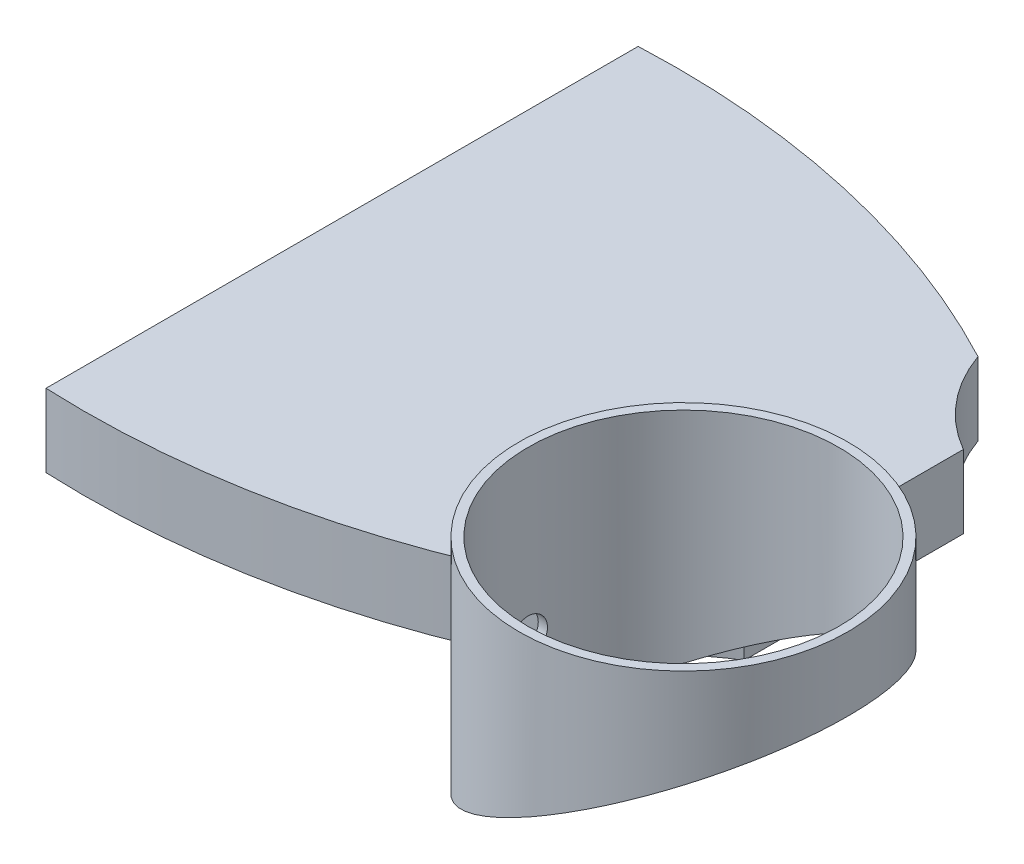
from build123d import *

# Parameters (mm, degrees)
SKETCH2_R               = 45
SKETCH2_R_2             = 42.5
BOSS_EXTRUDE1_DEPTH     = 60
CUT_EXTRUDE1_DEPTH      = 88.464278423
CUT_EXTRUDE1_DEPTH_BACK = 88.464278423
CUT_EXTRUDE2_DEPTH      = 88.464278423
CUT_EXTRUDE2_DEPTH_BACK = 88.464278423
SKETCH4_R               = 5
BOSS_EXTRUDE2_DEPTH     = 20
MIRROR1_DEPTH           = 20


# Read off the part's stored shape, not the designer's step: Mirror1
with BuildPart() as part:
    # Sketch2 → Boss-Extrude1 (new body)
    with BuildSketch(Plane(origin=(0, 0, 0), x_dir=(1, 0, 0), z_dir=(0, 1, 0))):
        with Locations(Location((0, 0, 0), (0, 0, 270))):
            Circle(SKETCH2_R)
        with Locations(Location((0, 0, 0), (0, 0, 270))):
            Circle(SKETCH2_R_2, mode=Mode.SUBTRACT)
    extrude(amount=BOSS_EXTRUDE1_DEPTH)

    # Sketch3 → Cut-Extrude1 (cut, two sides: drawn at the far end of the back side and taken through both)
    with BuildSketch(Plane.XY.offset(-CUT_EXTRUDE1_DEPTH_BACK)):
        Polygon((-30, 0), (45, 40), (45, 0), align=None)
    extrude(amount=CUT_EXTRUDE1_DEPTH + CUT_EXTRUDE1_DEPTH_BACK, mode=Mode.SUBTRACT)

    # Sketch4 → Cut-Extrude2 (cut, two sides: drawn at the far end of the back side and taken through both)
    with BuildSketch(Plane(origin=(0, 0, 0), x_dir=(0, 0, -1), z_dir=(1, 0, 0)).offset(-CUT_EXTRUDE2_DEPTH_BACK)):
        with Locations((0, 15)):
            Circle(SKETCH4_R)
    extrude(amount=CUT_EXTRUDE2_DEPTH + CUT_EXTRUDE2_DEPTH_BACK, mode=Mode.SUBTRACT)

    # Sketch5 → Boss-Extrude2 (add)
    with BuildSketch(Plane(origin=(0, 0, 0), x_dir=(1, 0, 0), z_dir=(0, 1, 0))):
        with BuildLine():
            ThreePointArc((-22.426406871, 39.013539635), (-34.577946498, 28.798708582), (-42.426406871, 15))
            ThreePointArc((-42.426406871, 15), (-100.617737833, -6.538529057), (-162.426406871, -12))
            Line((-162.426406871, -12), (-162.426406871, 69.013539635))
            Line((-162.426406871, 69.013539635), (-22.426406871, 69.013539635))
            Line((-22.426406871, 69.013539635), (-22.426406871, 39.013539635))
        make_face()
    extrude(amount=BOSS_EXTRUDE2_DEPTH)

    # Mirror1 outline → Mirror1 (add)
    with BuildSketch(Plane(origin=(0, 0, 0), x_dir=(1, 0, 0), z_dir=(0, 1, 0))):
        with BuildLine():
            Line((-22.426406871, 69.013539635), (-22.426406871, 99.013539635))
            ThreePointArc((-22.426406871, 99.013539635), (-34.577946498, 109.228370688), (-42.426406871, 123.02707927))
            ThreePointArc((-42.426406871, 123.02707927), (-100.617737833, 144.565608327), (-162.426406871, 150.02707927))
            Line((-162.426406871, 150.02707927), (-162.426406871, 69.013539635))
            Line((-162.426406871, 69.013539635), (-22.426406871, 69.013539635))
        make_face()
    extrude(amount=MIRROR1_DEPTH)


solid = part.part
